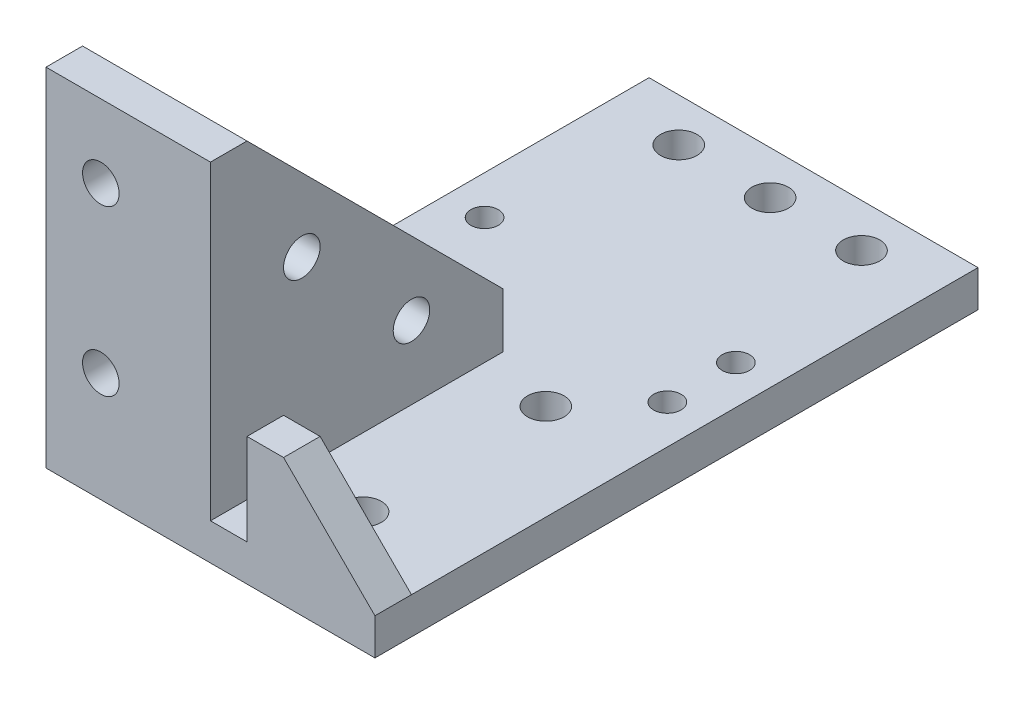
from build123d import *

# Parameters (mm, degrees)
BOSS_EXTRUDE1_DEPTH = 4
SKETCH2_R           = 2
SKETCH2_R_2         = 1.5
CUT_EXTRUDE1_DEPTH  = 69.527366796
BOSS_EXTRUDE5_DEPTH = 4
SKETCH6_W           = 14
SKETCH6_H           = 34
BOSS_EXTRUDE6_DEPTH = 4
BOSS_EXTRUDE7_DEPTH = 4
SKETCH8_R           = 2
CUT_EXTRUDE2_DEPTH  = 80.27168473
SKETCH9_R           = 2
CUT_EXTRUDE3_DEPTH  = 4


with BuildPart() as part:
    # Sketch1 → Boss-Extrude1 (new body)
    with BuildSketch(Plane(origin=(0, 0, 0), x_dir=(1, 0, 0), z_dir=(0, 1, 0))):
        Polygon((-18, 66), (18, 66), (18, 6), (18, 0), (-18, 0), (-18, 6), align=None)
    extrude(amount=BOSS_EXTRUDE1_DEPTH)

    # Sketch2 → Cut-Extrude1 (cut, through all)
    with BuildSketch(Plane(origin=(0, 4, 0), x_dir=(1, 0, 0), z_dir=(0, 1, 0))):
        with Locations((-10, 61.25)):
            Circle(SKETCH2_R)
        with Locations((0, 61.25)):
            Circle(SKETCH2_R)
        with Locations((10, 61.25)):
            Circle(SKETCH2_R)
        with Locations((-7.5, 9.2)):
            Circle(SKETCH2_R)
        with Locations((-7.5, 29.2)):
            Circle(SKETCH2_R)
        with Locations((7.5, 29.2)):
            Circle(SKETCH2_R)
        with Locations((7.5, 9.2)):
            Circle(SKETCH2_R)
        with Locations((13.75, 36.25)):
            Circle(SKETCH2_R_2)
        with Locations((13.75, 43.75)):
            Circle(SKETCH2_R_2)
        with Locations((-13.75, 43.75)):
            Circle(SKETCH2_R_2)
        with Locations((-13.75, 36.25)):
            Circle(SKETCH2_R_2)
    extrude(amount=-CUT_EXTRUDE1_DEPTH, mode=Mode.SUBTRACT)

    # Sketch5 → Boss-Extrude5 (add)
    with BuildSketch(Plane(origin=(0, 0, 0), x_dir=(0, 0, -1), z_dir=(1, 0, 0))):
        Polygon((0, 4), (0, 38), (4, 38), (32, 10), (32, 4), align=None)
    extrude(amount=-BOSS_EXTRUDE5_DEPTH)

    # Sketch6 → Boss-Extrude6 (add)
    with BuildSketch(Plane.XY):
        with Locations((-11, 21)):
            Rectangle(SKETCH6_W, SKETCH6_H)
    extrude(amount=-BOSS_EXTRUDE6_DEPTH)

    # Sketch7 → Boss-Extrude7 (add)
    with BuildSketch(Plane.XY):
        Polygon((4, 4), (4, 14), (8, 14), (18, 4), align=None)
    extrude(amount=-BOSS_EXTRUDE7_DEPTH)

    # Sketch8 → Cut-Extrude2 (cut, through all)
    with BuildSketch(Plane.ZY.offset(4)):
        with Locations((-10, 24)):
            Circle(SKETCH8_R)
        with Locations((-22, 12)):
            Circle(SKETCH8_R)
    extrude(amount=-CUT_EXTRUDE2_DEPTH, mode=Mode.SUBTRACT)

    # Sketch9 → Cut-Extrude3 (cut)
    with BuildSketch(Plane(origin=(0, 0, -4), x_dir=(-1, 0, 0), z_dir=(0, 0, -1))):
        with Locations((12, 12)):
            Circle(SKETCH9_R)
        with Locations((12, 30)):
            Circle(SKETCH9_R)
    extrude(amount=-CUT_EXTRUDE3_DEPTH, mode=Mode.SUBTRACT)


solid = part.part
